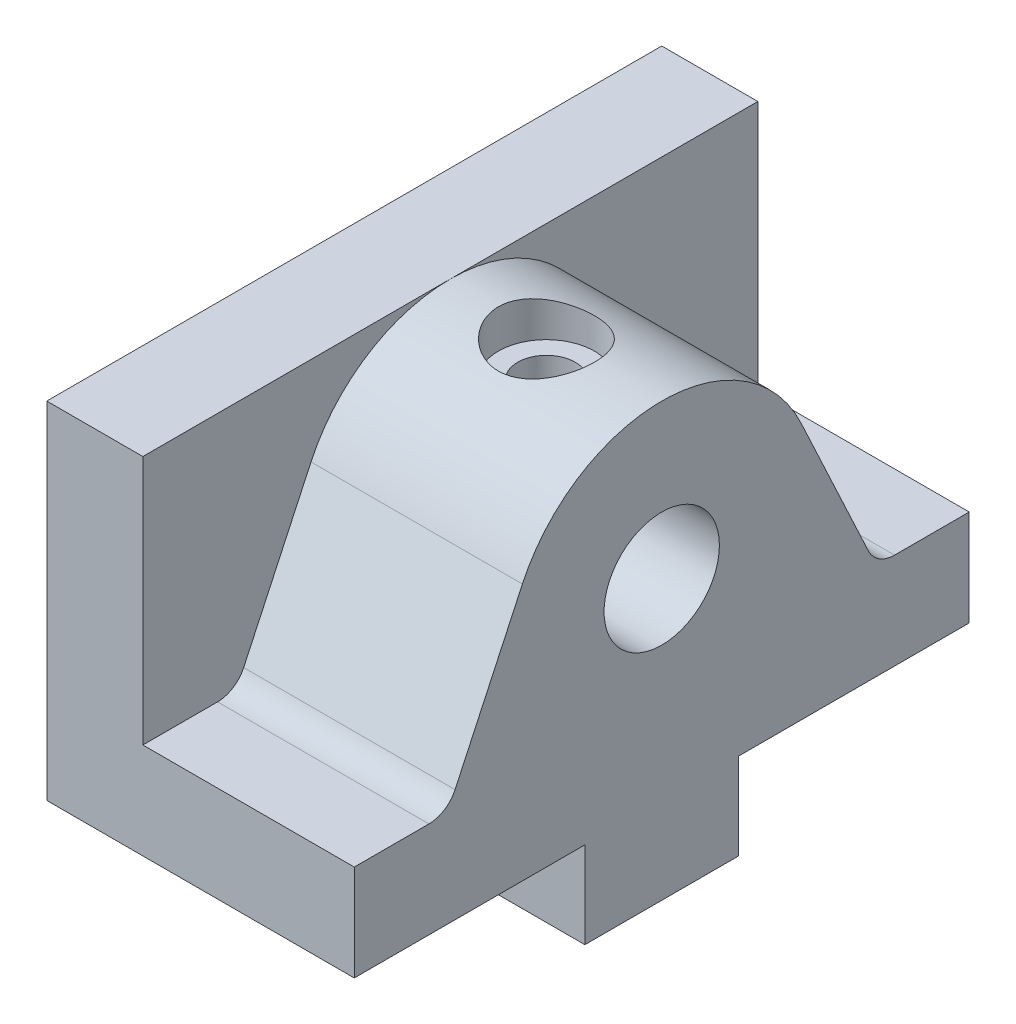
from build123d import *

# Parameters (mm, degrees)
BOSS_EXTRUDE1_DEPTH       = 32
BOSS_EXTRUDE2_REACH       = 59.827
SKETCH3_4_R               = 6
CUT_EXTRUDE1_DEPTH        = 24
SKETCH4_W                 = 16
SKETCH4_H                 = 9
BOSS_EXTRUDE3_DEPTH       = 32
F_6_0MM_DOWEL_HOLE1_D     = 6
F_6_0MM_DOWEL_HOLE1_DEPTH = 16
F_6_0MM_DOWEL_HOLE1_TIP   = 1.802581857


# Read off the part's stored shape, not the designer's step: CBORE for M5 Hex Head Bolt1
with BuildPart() as part:
    # Sketch1 → Boss-Extrude1 (new, symmetric)
    with BuildSketch(Plane.XY):
        Polygon((0, 36), (0, 0), (32, 0), (32, 10), (10, 10), (10, 36), align=None)
    extrude(amount=BOSS_EXTRUDE1_DEPTH, both=True)

    # Sketch3 → Boss-Extrude2 (add, up to next)
    with BuildSketch(Plane(origin=(32, 0, 0), x_dir=(0, 0, -1), z_dir=(1, 0, 0)), mode=Mode.PRIVATE) as boss_extrude2_sk1:
        with BuildLine():
            Line((14.500924593, 26.761892188), (21.509410706, 11.732145215))
            ThreePointArc((21.509410706, 11.732145215), (22.616435242, 10.469825663), (24.228334067, 10))
            Line((24.228334067, 10), (-24.228334067, 10))
            ThreePointArc((-24.228334067, 10), (-22.616435242, 10.469825663), (-21.509410706, 11.732145215))
            Line((-21.509410706, 11.732145215), (-14.500924593, 26.761892188))
            ThreePointArc((-14.500924593, 26.761892188), (0, 36), (14.500924593, 26.761892188))
        make_face()
    boss_extrude2_tool1 = extrude(boss_extrude2_sk1.sketch, amount=-BOSS_EXTRUDE2_REACH, mode=Mode.PRIVATE) - part.part
    add(boss_extrude2_tool1.solids().sort_by_distance((32, 20.8085, 0))[0])

    # Sketch3<4> → Cut-Extrude1 (cut)
    with BuildSketch(Plane(origin=(32, 0, 0), x_dir=(0, 0, -1), z_dir=(1, 0, 0))):
        with Locations((0, 20)):
            Circle(SKETCH3_4_R)
    extrude(amount=-CUT_EXTRUDE1_DEPTH, mode=Mode.SUBTRACT)

    # Sketch4 → Boss-Extrude3 (add)
    with BuildSketch(Plane(origin=(32, 0, 0), x_dir=(0, 0, -1), z_dir=(1, 0, 0))):
        with Locations((0, -4.5)):
            Rectangle(SKETCH4_W, SKETCH4_H)
    extrude(amount=-BOSS_EXTRUDE3_DEPTH)

    # Ø6.0mm Dowel Hole1
    with Locations(Plane(origin=(0, -9, 0), x_dir=(-1, 0, 0), z_dir=(0, -1, 0))):
        with Locations((-8, 0), (-24, 0)):
            Hole(F_6_0MM_DOWEL_HOLE1_D / 2, depth=F_6_0MM_DOWEL_HOLE1_DEPTH)
            with Locations((0, 0, -(F_6_0MM_DOWEL_HOLE1_DEPTH + F_6_0MM_DOWEL_HOLE1_TIP / 2))):  # 118° drill point
                Cone(0, F_6_0MM_DOWEL_HOLE1_D / 2, F_6_0MM_DOWEL_HOLE1_TIP, mode=Mode.SUBTRACT)

    # CBORE for M5 Hex Head Bolt1 outline → CBORE for M5 Hex Head Bolt1 (revolve, cut)
    with BuildSketch(Plane(origin=(20, 0, 0), x_dir=(1, 0, 0), z_dir=(0, 0, 1))):
        Polygon((0, 25.195854076), (3, 25.195854076), (3, 32), (5, 32), (5, 36.000103319), (0, 36.000103319), align=None)
    revolve(axis=Axis((20, 0, 0), (0, 1, 0)), mode=Mode.SUBTRACT)


solid = part.part
